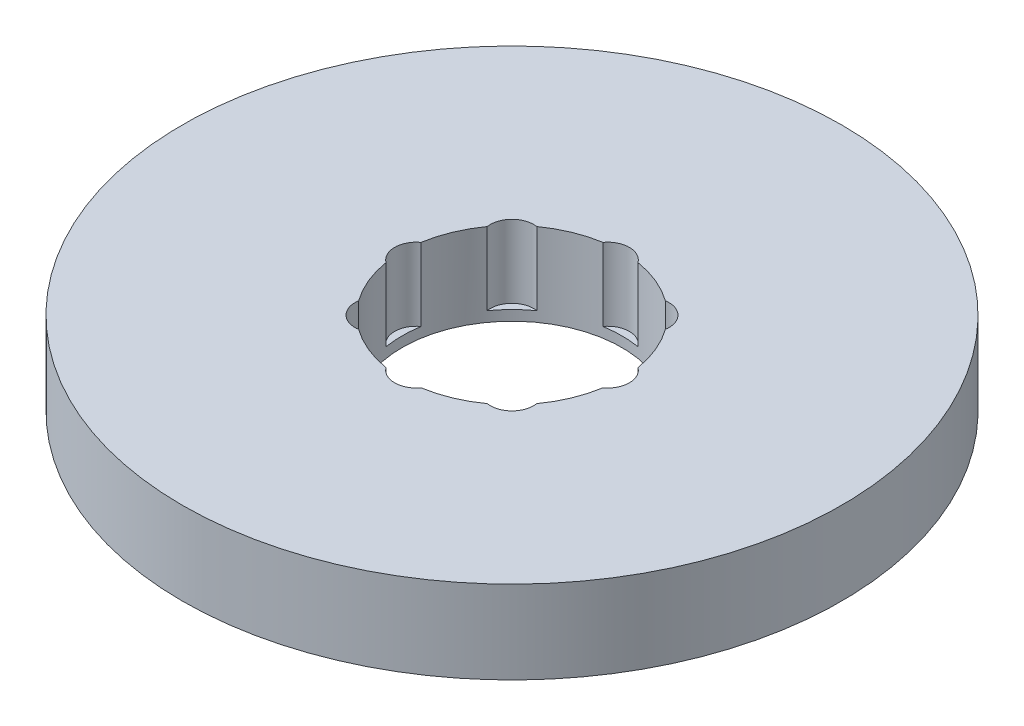
from build123d import *

# Parameters (mm, degrees)
SKETCH1_R           = 67.5
BOSS_EXTRUDE1_DEPTH = 17
SKETCH2_R           = 22.5
CUT_EXTRUDE1_DEPTH  = 97.961332499
SKETCH3_R           = 4.442902141
CUT_EXTRUDE2_DEPTH  = 14.915280347
CIRPATTERN1_COUNT   = 8


with BuildPart() as part:
    # Sketch1 → Boss-Extrude1 (new body)
    with BuildSketch(Plane(origin=(0, 0, 0), x_dir=(1, 0, 0), z_dir=(0, 1, 0))):
        Circle(SKETCH1_R)
    extrude(amount=BOSS_EXTRUDE1_DEPTH)

    # Sketch2 → Cut-Extrude1 (cut, through all)
    with BuildSketch(Plane(origin=(0, 0, 0), x_dir=(1, 0, 0), z_dir=(0, 1, 0))):
        Circle(SKETCH2_R)
    extrude(amount=CUT_EXTRUDE1_DEPTH, mode=Mode.SUBTRACT)

    # Sketch3 → Cut-Extrude2 (cut)
    with BuildSketch(Plane(origin=(0, 17, 0), x_dir=(1, 0, 0), z_dir=(0, 1, 0))):
        with Locations((-19.592855779, 0)):
            Circle(SKETCH3_R)
    cut_extrude2 = extrude(amount=-CUT_EXTRUDE2_DEPTH, mode=Mode.SUBTRACT)

    # CirPattern1: Cut-Extrude2 ×8 about axis
    cirpattern1_axis = Axis((0, 0, 0), (0, 1, 0))
    for i in range(1, CIRPATTERN1_COUNT):
        add(cut_extrude2.rotate(cirpattern1_axis, i * 360 / CIRPATTERN1_COUNT), mode=Mode.SUBTRACT)


solid = part.part
